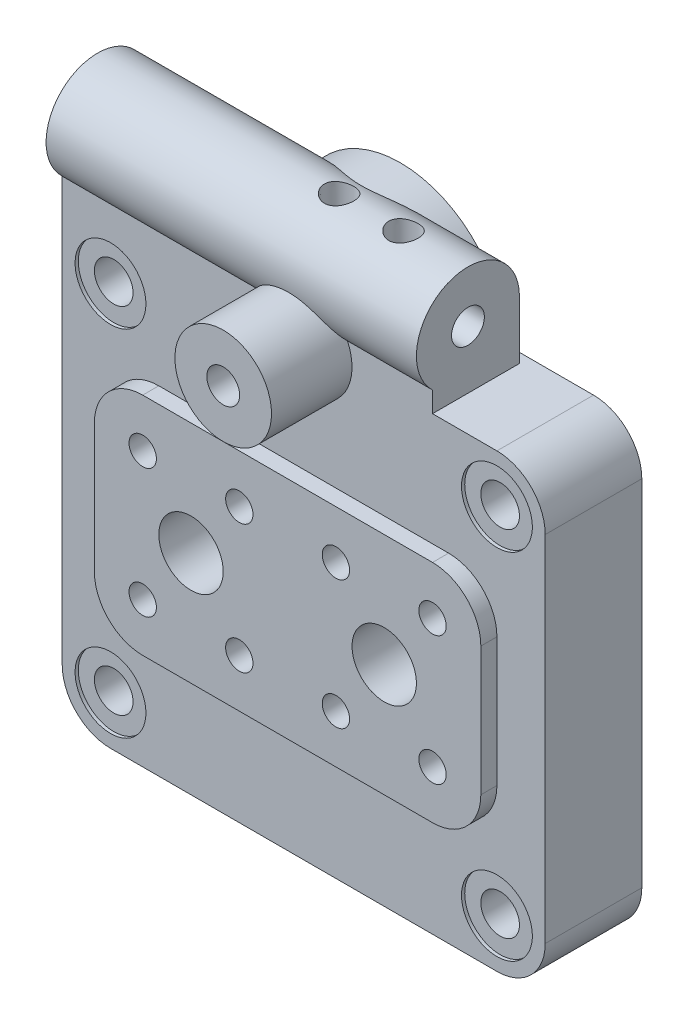
from build123d import *
from build123d.topology import SkipClean

# Parameters (mm, degrees)
SKETCH_1_W                                 = 150
SKETCH_1_H                                 = 140
SKETCH_1_W_2                               = 115
SKETCH_1_H_2                               = 18
EXTRUDE_1_DEPTH                            = 30
EXTRUDE_2_DEPTH                            = 5
EXTRUDE_START                              = 40
SKETCH_3_R                                 = 16
EXTRUDE_3_DEPTH                            = 115
SKETCH_4_R                                 = 15
EXTRUDE_4_DEPTH                            = 55
EXTRUDE_5_REACH                            = 141.521
SKETCH_5_R                                 = 32.5
FILLET_1_R                                 = 15
SKETCH_6_R                                 = 11
CUT_EXTRUDE_1_DEPTH                        = 1
SKETCH_7_R                                 = 6
CUT_EXTRUDE_2_DEPTH                        = 132.461020997
MIRROR_1_AT_THE_SECOND_PLANE_COPY_1_SKET_R = 11
MIRROR_1_AT_THE_SECOND_PLANE_COPY_1_DEPTH  = 1
MIRROR_1_AT_THE_SECOND_PLANE_COPY_2_SKET_R = 6
MIRROR_1_AT_THE_SECOND_PLANE_COPY_2_DEPTH  = 132.461020997
SKETCH_8_R                                 = 10
CUT_EXTRUDE_3_DEPTH                        = 30
HOLE_WIZARD_M10_1_AT_2_COUNT               = 2
HOLE_WIZARD_M10_1_AT_2_PITCH               = 40
PATTERN_LINEAR_1_COUNT                     = 4
PATTERN_LINEAR_1_PITCH                     = 30
CUT_EXTRUDE_1_2_DEPTH                      = 5
FILLET_2_R                                 = 2.5
CUT_EXTRUDE_START                          = -5
CUT_EXTRUDE_2_2_DEPTH                      = 15
CUT_EXTRUDE_START_2                        = -17
SKETCH_14_R                                = 11
CUT_EXTRUDE_4_DEPTH                        = 3
HOLE_WIZARD_M20_1_D                        = 17.5
HOLE_WIZARD_M20_1_DEPTH                    = 17
SKETCH_17_R                                = 8
CUT_EXTRUDE_5_DEPTH                        = 65
SKETCH_18_R                                = 3
CUT_EXTRUDE_6_DEPTH                        = 146.141310562
HOLE_WIZARD_M12_1_D                        = 10.2
HOLE_WIZARD_M12_1_DEPTH                    = 13
HOLE_WIZARD_M12_1_TIP                      = 3.064389157
CUT_EXTRUDE_START_3                        = 36
SKETCH_21_R                                = 7
CUT_EXTRUDE_7_DEPTH                        = 3
HOLE_WIZARD_M12_2_D                        = 10.2
HOLE_WIZARD_M12_2_DEPTH                    = 16
SKETCH_24_R                                = 4.5
CUT_EXTRUDE_8_DEPTH                        = 134.180329039
SKETCH_25_R                                = 9
CUT_EXTRUDE_9_DEPTH                        = 21
CUT_EXTRUDE_START_4                        = -15
SKETCH_26_R                                = 11
CUT_EXTRUDE_10_DEPTH                       = 6
F_1_8_RC_2_AT_2_COUNT                      = 2
F_1_8_RC_2_AT_2_PITCH                      = 20
SKETCH_30_R                                = 1.5
CUT_EXTRUDE_11_DEPTH                       = 32
SKETCH_31_R                                = 1.5
CUT_EXTRUDE_12_DEPTH                       = 82
F_5_0MM_1_D                                = 5
F_5_0MM_1_DEPTH                            = 10
F_5_0MM_1_TIP                              = 1.502151548
PATTERN_CIRCULAR_1_COUNT                   = 2
CUT_EXTRUDE_13_DEPTH                       = 140.520607965
CUT_EXTRUDE_13_DEPTH_BACK                  = 3
FILLET_3_R                                 = 15
SKETCH_38_R                                = 14
CUT_EXTRUDE_14_DEPTH                       = 16


# Read off the part's stored shape, not the designer's step: Ø5.0mm 暗销孔2, Ø24.0 (24) 直径孔1
with BuildPart() as part:
    # 草图1 → 凸台-拉伸1 (new body)
    with BuildSketch(Plane.XY):
        Rectangle(SKETCH_1_W, SKETCH_1_H)
        with Locations((-17.5, 79)):
            Rectangle(SKETCH_1_W_2, SKETCH_1_H_2)
    extrude(amount=EXTRUDE_1_DEPTH)

    # 草图2 → 凸台-拉伸2 (add)
    with BuildSketch(Plane.XY.offset(30)):
        with BuildLine():
            Line((-45, -35), (45, -35))
            ThreePointArc((45, -35), (55.606601718, -30.606601718), (60, -20))
            Line((60, -20), (60, 20))
            ThreePointArc((60, 20), (55.606601718, 30.606601718), (45, 35))
            Line((45, 35), (-45, 35))
            ThreePointArc((-45, 35), (-55.606601718, 30.606601718), (-60, 20))
            Line((-60, 20), (-60, -20))
            ThreePointArc((-60, -20), (-55.606601718, -30.606601718), (-45, -35))
        make_face()
    extrude(amount=EXTRUDE_2_DEPTH)

    # 草图3 → 凸台-拉伸3 (add)
    with BuildSketch(Plane(origin=(0, 0, 0), x_dir=(0, 0, -1), z_dir=(1, 0, 0)).offset(EXTRUDE_START)):
        with Locations((-19, 88)):
            Circle(SKETCH_3_R)
    extrude(amount=-EXTRUDE_3_DEPTH)

    # 草图4 → 凸台-拉伸4 (add)
    with BuildSketch(Plane.XY):
        with Locations(Location((0, 70, 0), (0, 0, 154.823804397))):
            Circle(SKETCH_4_R)
    extrude(amount=EXTRUDE_4_DEPTH)

    # 草图5 → 凸台-拉伸5 (add, up to next)
    with BuildSketch(Plane(origin=(0, 0, 0), x_dir=(-1, 0, 0), z_dir=(0, 0, -1)), mode=Mode.PRIVATE) as extrude_5_sk1:
        with Locations((0, 70)):
            Circle(SKETCH_5_R)
    extrude_5_tool1 = extrude(extrude_5_sk1.sketch, amount=-EXTRUDE_5_REACH, mode=Mode.PRIVATE) - part.part
    add(extrude_5_tool1.solids().sort_by_distance((0, 70, 0))[0])

    # 圆角1
    fillet_1_edges = [part.edges().sort_by_distance(p)[0] for p in [
        (-75, -70, 15),
        (75, 70, 15),
        (75, -70, 15),
    ]]
    fillet(fillet_1_edges, radius=FILLET_1_R)

    # 草图6 → Cut-Extrude 1 (cut)
    with BuildSketch(Plane.XY.offset(30)):
        with Locations((-60, -55)):
            Circle(SKETCH_6_R)
    cut_extrude_1 = extrude(amount=-CUT_EXTRUDE_1_DEPTH, mode=Mode.SUBTRACT)

    # 草图7 → Cut-Extrude 2 (cut, through all)
    with BuildSketch(Plane.XY.offset(29)):
        with Locations((-60, -55)):
            Circle(SKETCH_7_R)
    cut_extrude_2 = extrude(amount=-CUT_EXTRUDE_2_DEPTH, mode=Mode.SUBTRACT)

    # 镜向1: Cut-Extrude 1, Cut-Extrude 2 across plane
    add(cut_extrude_1.mirror(Plane.ZX), mode=Mode.SUBTRACT)
    add(cut_extrude_2.mirror(Plane.ZX), mode=Mode.SUBTRACT)

    # 镜向1 at the second plane: Cut-Extrude 1, Cut-Extrude 2 across plane
    add(cut_extrude_1.mirror(Plane(origin=(0, 0, 0), x_dir=(0, 0, 1), z_dir=(1, 0, 0))), mode=Mode.SUBTRACT)
    add(cut_extrude_2.mirror(Plane(origin=(0, 0, 0), x_dir=(0, 0, 1), z_dir=(1, 0, 0))), mode=Mode.SUBTRACT)

    # 镜向1 at the second plane copy 1 sket → 镜向1 at the second plane copy 1 (cut)
    with BuildSketch(Plane(origin=(0, 0, 30), x_dir=(-1, 0, 0), z_dir=(0, 0, 1))):
        with Locations((-60, -55)):
            Circle(MIRROR_1_AT_THE_SECOND_PLANE_COPY_1_SKET_R)
    extrude(amount=-MIRROR_1_AT_THE_SECOND_PLANE_COPY_1_DEPTH, mode=Mode.SUBTRACT)

    # 镜向1 at the second plane copy 2 sket → 镜向1 at the second plane copy 2 (cut, through all)
    with BuildSketch(Plane(origin=(0, 0, 29), x_dir=(-1, 0, 0), z_dir=(0, 0, 1))):
        with Locations((-60, -55)):
            Circle(MIRROR_1_AT_THE_SECOND_PLANE_COPY_2_SKET_R)
    extrude(amount=-MIRROR_1_AT_THE_SECOND_PLANE_COPY_2_DEPTH, mode=Mode.SUBTRACT)

    # 草图8 → 切除-拉伸3 (cut)
    with BuildSketch(Plane.XY.offset(35)):
        with Locations((-30, 0)):
            Circle(SKETCH_8_R)
        with Locations((30, 0)):
            Circle(SKETCH_8_R)
    extrude(amount=-CUT_EXTRUDE_3_DEPTH, mode=Mode.SUBTRACT)

    # 草图10 → M10 螺纹孔1 (revolve, cut)
    with BuildSketch(Plane(origin=(-45, 20, 35), x_dir=(0, -1, 0), z_dir=(1, 0, 0))):
        Polygon((0, 0), (0, 25.553657631), (4.25, 23), (4.25, 0), align=None)
    hole_wizard_m10_1 = revolve(axis=Axis((-45, 20, 41.35), (0, 0, -1)), mode=Mode.SUBTRACT)

    # M10 螺纹孔1 at 2: M10 螺纹孔1 ×2
    with Locations(*[(0, -i * HOLE_WIZARD_M10_1_AT_2_PITCH, 0) for i in range(1, HOLE_WIZARD_M10_1_AT_2_COUNT)]):
        add(hole_wizard_m10_1, mode=Mode.SUBTRACT)

    # 阵列(线性)1: M10 螺纹孔1 ×4
    with Locations(*[(i * PATTERN_LINEAR_1_PITCH, 0, 0) for i in range(1, PATTERN_LINEAR_1_COUNT)]):
        add(hole_wizard_m10_1, mode=Mode.SUBTRACT)

    # 阵列(线性)1 copy 1 sketch → 阵列(线性)1 copy 1 (revolve, cut)
    with BuildSketch(Plane(origin=(-15, -20, 35), x_dir=(0, -1, 0), z_dir=(1, 0, 0))):
        Polygon((0, 0), (0, 25.553657631), (4.25, 23), (4.25, 0), align=None)
    revolve(axis=Axis((-15, -20, 41.35), (0, 0, -1)), mode=Mode.SUBTRACT)

    # 阵列(线性)1 copy 2 sketch → 阵列(线性)1 copy 2 (revolve, cut)
    with BuildSketch(Plane(origin=(15, -20, 35), x_dir=(0, -1, 0), z_dir=(1, 0, 0))):
        Polygon((0, 0), (0, 25.553657631), (4.25, 23), (4.25, 0), align=None)
    revolve(axis=Axis((15, -20, 41.35), (0, 0, -1)), mode=Mode.SUBTRACT)

    # 阵列(线性)1 copy 3 sketch → 阵列(线性)1 copy 3 (revolve, cut)
    with BuildSketch(Plane(origin=(45, -20, 35), x_dir=(0, -1, 0), z_dir=(1, 0, 0))):
        Polygon((0, 0), (0, 25.553657631), (4.25, 23), (4.25, 0), align=None)
    revolve(axis=Axis((45, -20, 41.35), (0, 0, -1)), mode=Mode.SUBTRACT)

    # 草图11 → Cut-Extrude 1 2 (cut)
    with BuildSketch(Plane(origin=(0, 0, 0), x_dir=(-1, 0, 0), z_dir=(0, 0, -1))):
        with BuildLine():
            ThreePointArc((8.411618966, -31.392589354), (32.5, 0), (8.411618966, 31.392589354))
            Line((8.411618966, 31.392589354), (7.11752374, 26.562960223))
            ThreePointArc((7.11752374, 26.562960223), (27.5, 0), (7.11752374, -26.562960223))
            Line((7.11752374, -26.562960223), (8.411618966, -31.392589354))
        make_face()
    cut_extrude_1_2 = extrude(amount=-CUT_EXTRUDE_1_2_DEPTH, mode=Mode.SUBTRACT)

    # 镜向2: Cut-Extrude 1 2 across plane
    add(cut_extrude_1_2.mirror(Plane(origin=(0, 0, 0), x_dir=(0, 0, 1), z_dir=(1, 0, 0))), mode=Mode.SUBTRACT)

    # 圆角2
    fillet_2_edges = [part.edges().sort_by_distance(p)[0] for p in [
        (8.411618966, -31.392589354, 2.5),
        (7.11752374, -26.562960223, 2.5),
        (7.11752374, 26.562960223, 2.5),
        (8.411618966, 31.392589354, 2.5),
        (-7.11752374, 26.562960223, 2.5),
        (-7.11752374, -26.562960223, 2.5),
        (-8.411618966, -31.392589354, 2.5),
        (-8.411618966, 31.392589354, 2.5),
    ]]
    fillet(fillet_2_edges, radius=FILLET_2_R - 0.0001)  # a hair under: the kernel refuses the full size

    # 草图13 → Cut-Extrude 2 2 (cut)
    with BuildSketch(Plane(origin=(0, 0, 0), x_dir=(-1, 0, 0), z_dir=(0, 0, -1)).offset(CUT_EXTRUDE_START)):
        with BuildLine():
            Line((6.006095586, -39.801718755), (10.352761804, -38.637033052))
            ThreePointArc((10.352761804, -38.637033052), (40, 0), (10.352761804, 38.637033052))
            Line((10.352761804, 38.637033052), (6.006095586, 39.801718755))
            Line((6.006095586, 39.801718755), (0.829714684, 20.483202229))
            Line((0.829714684, 20.483202229), (5.176380902, 19.318516526))
            ThreePointArc((5.176380902, 19.318516526), (20, 0), (5.176380902, -19.318516526))
            Line((5.176380902, -19.318516526), (0.829714684, -20.483202229))
            Line((0.829714684, -20.483202229), (6.006095586, -39.801718755))
        make_face()
    cut_extrude_2_2 = extrude(amount=-CUT_EXTRUDE_2_2_DEPTH, mode=Mode.SUBTRACT)

    # 镜向3: Cut-Extrude 2 2 across plane
    add(cut_extrude_2_2.mirror(Plane(origin=(0, 0, 0), x_dir=(0, 0, 1), z_dir=(1, 0, 0))), mode=Mode.SUBTRACT)

    # 草图14 → 切除-拉伸4 (cut)
    with BuildSketch(Plane.ZY.offset(75).offset(CUT_EXTRUDE_START_2)):
        with Locations(Location((19, 88, 0), (0, 0, 270))):
            Circle(SKETCH_14_R)
    extrude(amount=-CUT_EXTRUDE_4_DEPTH, mode=Mode.SUBTRACT)

    # M20 螺纹孔1
    with Locations(Plane.ZY.offset(75)):
        with Locations((19, 88)):
            Hole(HOLE_WIZARD_M20_1_D / 2, depth=HOLE_WIZARD_M20_1_DEPTH)

    # 草图17 → 切除-拉伸5 (cut)
    with BuildSketch(Plane.ZY.offset(75)):
        with Locations(Location((19, 88, 0), (0, 0, 270))):
            Circle(SKETCH_17_R)
    extrude(amount=-CUT_EXTRUDE_5_DEPTH, mode=Mode.SUBTRACT)

    # 草图18 → 切除-拉伸6 (cut, through all)
    with BuildSketch(Plane.ZY.offset(10)):
        with Locations(Location((19, 88, 0), (0, 0, 270))):
            Circle(SKETCH_18_R)
    extrude(amount=-CUT_EXTRUDE_6_DEPTH, mode=Mode.SUBTRACT)

    # M12 螺纹孔1
    with Locations(Plane(origin=(40, 0, 0), x_dir=(0, 0, -1), z_dir=(1, 0, 0))):
        with Locations((-19, 88)):
            Hole(HOLE_WIZARD_M12_1_D / 2, depth=HOLE_WIZARD_M12_1_DEPTH)
            with Locations((0, 0, -(HOLE_WIZARD_M12_1_DEPTH + HOLE_WIZARD_M12_1_TIP / 2))):  # 118° drill point
                Cone(0, HOLE_WIZARD_M12_1_D / 2, HOLE_WIZARD_M12_1_TIP, mode=Mode.SUBTRACT)

    # 草图21 → 切除-拉伸7 (cut)
    with BuildSketch(Plane.XY.offset(CUT_EXTRUDE_START_3)):
        with Locations((0, 70)):
            Circle(SKETCH_21_R)
    extrude(amount=CUT_EXTRUDE_7_DEPTH, mode=Mode.SUBTRACT)

    # M12 螺纹孔2
    with Locations(Plane.XY.offset(55)):
        with Locations((0, 70)):
            Hole(HOLE_WIZARD_M12_2_D / 2, depth=HOLE_WIZARD_M12_2_DEPTH)

    # 草图24 → 切除-拉伸8 (cut, through all)
    with BuildSketch(Plane.XY.offset(36)):
        with Locations((0, 70)):
            Circle(SKETCH_24_R)
    extrude(amount=-CUT_EXTRUDE_8_DEPTH, mode=Mode.SUBTRACT)

    # 草图25 → 切除-拉伸9 (cut)
    with BuildSketch(Plane(origin=(0, 0, 0), x_dir=(-1, 0, 0), z_dir=(0, 0, -1))):
        with Locations((0, 70)):
            Circle(SKETCH_25_R)
    extrude(amount=-CUT_EXTRUDE_9_DEPTH, mode=Mode.SUBTRACT)

    # 草图26 → 切除-拉伸10 (cut)
    with BuildSketch(Plane(origin=(0, 0, 0), x_dir=(-1, 0, 0), z_dir=(0, 0, -1)).offset(CUT_EXTRUDE_START_4)):
        with Locations((0, 70)):
            Circle(SKETCH_26_R)
    extrude(amount=-CUT_EXTRUDE_10_DEPTH, mode=Mode.SUBTRACT)

    # 草图29 → 1/8 Rc 螺纹孔2 (revolve, cut)
    with BuildSketch(Plane(origin=(0, 104, 19), x_dir=(0, 0, 1), z_dir=(1, 0, 0))):
        Polygon((0, 0), (0, 12.373399445), (3.95, 10), (3.95, 7.4), (4.342497004, 7.4), (4.5735, 0), align=None)
    f_1_8_rc_2 = revolve(axis=Axis((0, 110.35, 19), (0, -1, 0)), mode=Mode.SUBTRACT)

    # 1/8 Rc 螺纹孔2 at 2: 1/8 Rc 螺纹孔2 ×2
    with Locations(*[(i * F_1_8_RC_2_AT_2_PITCH, 0, 0) for i in range(1, F_1_8_RC_2_AT_2_COUNT)]):
        add(f_1_8_rc_2, mode=Mode.SUBTRACT)

    # 草图30 → 切除-拉伸11 (cut)
    with BuildSketch(Plane(origin=(0, 104, 0), x_dir=(1, 0, 0), z_dir=(0, 1, 0))):
        with Locations(Location((0, -19, 0), (0, 0, 270))):
            Circle(SKETCH_30_R)
    extrude(amount=-CUT_EXTRUDE_11_DEPTH, mode=Mode.SUBTRACT)

    # 草图31 → 切除-拉伸12 (cut)
    with BuildSketch(Plane(origin=(0, 104, 0), x_dir=(1, 0, 0), z_dir=(0, 1, 0))):
        with Locations(Location((20, -19, 0), (0, 0, 270))):
            Circle(SKETCH_31_R)
    extrude(amount=-CUT_EXTRUDE_12_DEPTH, mode=Mode.SUBTRACT)

    # Ø5.0mm 暗销孔1
    with Locations(Plane(origin=(0, 0, 0), x_dir=(-1, 0, 0), z_dir=(0, 0, -1))):
        with Locations((0, 40)):
            Hole(F_5_0MM_1_D / 2, depth=F_5_0MM_1_DEPTH)
            with Locations((0, 0, -(F_5_0MM_1_DEPTH + F_5_0MM_1_TIP / 2))):  # 118° drill point
                Cone(0, F_5_0MM_1_D / 2, F_5_0MM_1_TIP, mode=Mode.SUBTRACT)

    # Ø5.0mm 暗销孔2 outline → Ø5.0mm 暗销孔2 (revolve, cut)
    with BuildSketch(Plane(origin=(-70, -45, 0), x_dir=(1, 0, 0), z_dir=(0, -1, 0))):
        Polygon((2.5, 7.5), (0, 9.002151548), (0, 0), (2.5, 0), align=None)
    f_5_0mm_2 = revolve(axis=Axis((-70, -45, 0), (0, 0, 1)), mode=Mode.SUBTRACT)

    # 阵列(圆周)1: Ø5.0mm 暗销孔2 ×2 about axis
    pattern_circular_1_axis = Axis((0, 0, 0), (0, 0, 1))
    for i in range(1, PATTERN_CIRCULAR_1_COUNT):
        add(f_5_0mm_2.rotate(pattern_circular_1_axis, i * 360 / PATTERN_CIRCULAR_1_COUNT), mode=Mode.SUBTRACT)

    # 草图37 → 切除-拉伸13 (cut, two sides: drawn at the far end of the back side and taken through both)
    with SkipClean():  # the faces are left unmerged after this step: merging them gives an invalid solid
        with BuildSketch(Plane(origin=(0, 0, 0), x_dir=(-1, 0, 0), z_dir=(0, 0, -1)).offset(-CUT_EXTRUDE_13_DEPTH_BACK)):
            with BuildLine():
                Line((-460.365690574, 70), (-40, 70))
                Line((-40, 70), (-32.5, 70))
                ThreePointArc((-32.5, 70), (0, 102.5), (32.5, 70))
                Line((32.5, 70), (75, 70))
                Line((75, 70), (495.365690574, 70))
                Line((495.365690574, 70), (495.365690574, 910.731381147))
                Line((495.365690574, 910.731381147), (-460.365690574, 910.731381147))
                Line((-460.365690574, 910.731381147), (-460.365690574, 70))
            make_face()
        extrude(amount=CUT_EXTRUDE_13_DEPTH + CUT_EXTRUDE_13_DEPTH_BACK, mode=Mode.SUBTRACT)
    add(part.part.scale(1), mode=Mode.REPLACE)  # the faces are merged on a copy

    # 圆角3
    fillet_3_edges = [part.edges().sort_by_distance(p)[0] for p in [
        (-75, 70, 1.5),
    ]]
    fillet(fillet_3_edges, radius=FILLET_3_R)

    # 草图38 → 切除-拉伸14 (cut)
    with BuildSketch(Plane(origin=(0, 0, 0), x_dir=(-1, 0, 0), z_dir=(0, 0, -1))):
        Circle(SKETCH_38_R)
    extrude(amount=-CUT_EXTRUDE_14_DEPTH, mode=Mode.SUBTRACT)

    # Ø24.0 (24) 直径孔1 outline → Ø24.0 (24) 直径孔1 (revolve, cut)
    with BuildSketch(Plane.XZ):
        Polygon((12, 21), (0, 28.210327428), (0, 16), (12, 16), align=None)
    revolve(axis=Axis((0, 0, 0), (0, 0, 1)), mode=Mode.SUBTRACT)


solid = part.part
